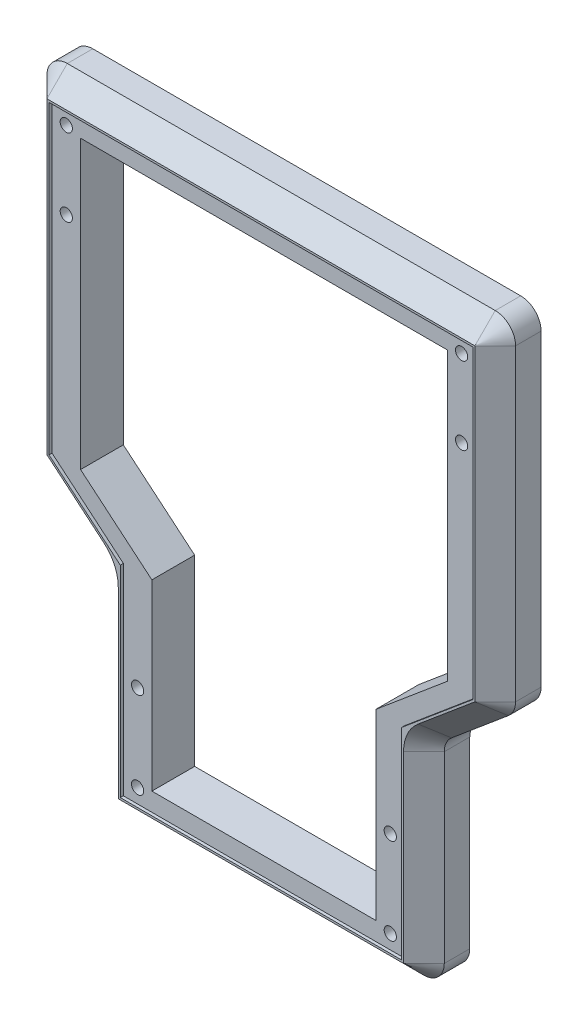
from build123d import *

# Parameters (mm, degrees)
RESSALTO_EXTRUS_O1_DEPTH = 22.5
CHANFRO1_SIZE            = 10
CORTE_EXTRUS_O1_REACH    = 324.073
ESBO_O3_W                = 1139.230904301
ESBO_O3_H                = 709.798033895
CORTE_EXTRUS_O5_DEPTH    = 1.5
ESBO_O5_R                = 3
CORTE_EXTRUS_O6_DEPTH    = 322.972048476
CORTE_EXTRUS_O8_DEPTH    = 10


with BuildPart() as part:
    # Esboço1 → Ressalto-extrusão1 (new, symmetric)
    with BuildSketch(Plane.XY):
        with BuildLine():
            Line((-70, 0), (70, 0))
            ThreePointArc((70, 0), (77.071067812, 2.928932188), (80, 10))
            Line((80, 10), (80, 100))
            ThreePointArc((80, 100), (80.93692213, 104.226182617), (83.572123903, 107.660444431))
            Line((83.572123903, 107.660444431), (111.427876097, 131.034195823))
            ThreePointArc((111.427876097, 131.034195823), (114.06307787, 134.468457637), (115, 138.694640254))
            Line((115, 138.694640254), (115, 290))
            ThreePointArc((115, 290), (112.071067812, 297.071067812), (105, 300))
            Line((105, 300), (-105, 300))
            ThreePointArc((-105, 300), (-112.071067812, 297.071067812), (-115, 290))
            Line((-115, 290), (-115, 138.694640254))
            ThreePointArc((-115, 138.694640254), (-114.06307787, 134.468457637), (-111.427876097, 131.034195823))
            Line((-111.427876097, 131.034195823), (-83.572123903, 107.660444431))
            ThreePointArc((-83.572123903, 107.660444431), (-80.93692213, 104.226182617), (-80, 100))
            Line((-80, 100), (-80, 10))
            ThreePointArc((-80, 10), (-77.071067812, 2.928932188), (-70, 0))
        make_face()
        Polygon((-55, 20), (55, 20), (55, 109.793731589), (90, 139.16221868), (90, 280), (-90, 280), (-90, 139.16221868), (-55, 109.793731589), align=None, mode=Mode.SUBTRACT)
    extrude(amount=RESSALTO_EXTRUS_O1_DEPTH, both=True)

    # Chanfro1
    chanfro1_edges = [part.edges().sort_by_distance(p)[0] for p in [
        (114.06307787, 134.468457637, 22.5),
        (115, 214.347320127, 22.5),
        (115, 214.347320127, -22.5),
        (114.06307787, 134.468457637, -22.5),
        (97.5, 119.347320127, -22.5),
        (80.93692213, 104.226182617, -22.5),
        (80, 55, -22.5),
        (77.071067812, 2.928932188, -22.5),
        (0, 0, -22.5),
        (-77.071067812, 2.928932188, -22.5),
        (-80, 55, -22.5),
        (-80.93692213, 104.226182617, -22.5),
        (-97.5, 119.347320127, -22.5),
        (-114.06307787, 134.468457637, -22.5),
        (-115, 214.347320127, -22.5),
        (-112.071067812, 297.071067812, -22.5),
        (0, 300, -22.5),
        (112.071067812, 297.071067812, -22.5),
        (112.071067812, 297.071067812, 22.5),
        (0, 300, 22.5),
        (-112.071067812, 297.071067812, 22.5),
        (-115, 214.347320127, 22.5),
        (-114.06307787, 134.468457637, 22.5),
        (-97.5, 119.347320127, 22.5),
        (-80.93692213, 104.226182617, 22.5),
        (-80, 55, 22.5),
        (-77.071067812, 2.928932188, 22.5),
        (0, 0, 22.5),
        (77.071067812, 2.928932188, 22.5),
        (80, 55, 22.5),
        (80.93692213, 104.226182617, 22.5),
        (97.5, 119.347320127, 22.5),
    ]]
    chamfer(chanfro1_edges, length=CHANFRO1_SIZE - 0.0001)  # a hair under: the kernel refuses the full size

    # Esboço3 → Corte-extrusão1 (cut, up to next)
    with BuildSketch(Plane.XY, mode=Mode.PRIVATE) as corte_extrus_o1_sk1:
        with Locations((-153.157436203, 152.53565808)):
            Rectangle(ESBO_O3_W, ESBO_O3_H)
    corte_extrus_o1_tool1 = extrude(corte_extrus_o1_sk1.sketch, amount=-CORTE_EXTRUS_O1_REACH, mode=Mode.PRIVATE) & part.part
    add(corte_extrus_o1_tool1.solids().sort_by_distance((-153.157436, 152.535658, 0))[0], mode=Mode.SUBTRACT)

    # Esboço4 → Corte-extrusão5 (cut)
    with BuildSketch(Plane.XY.offset(22.5)):
        Polygon((104, 289), (-104, 289), (-104, 139.160947912), (-69, 109.792460821), (-69, 11), (69, 11), (69, 109.792460821), (104, 139.160947912), align=None)
        Polygon((-90, 280), (-90, 139.16221868), (-55, 109.793731589), (-55, 20), (0, 20), (55, 20), (55, 109.793731589), (90, 139.16221868), (90, 280), align=None, mode=Mode.SUBTRACT)
    extrude(amount=-CORTE_EXTRUS_O5_DEPTH, mode=Mode.SUBTRACT)

    # Esboço5 → Corte-extrusão6 (cut, through all)
    with BuildSketch(Plane.XY.offset(21)):
        with Locations((-97, 244)):
            Circle(ESBO_O5_R)
        with Locations((-62, 60.396230411)):
            Circle(ESBO_O5_R)
        with Locations((-97, 282)):
            Circle(ESBO_O5_R)
        with Locations((-62, 18)):
            Circle(ESBO_O5_R)
        with Locations(Location((62, 18, 0), (0, 0, 180))):
            Circle(ESBO_O5_R)
        with Locations(Location((97, 282, 0), (0, 0, 180))):
            Circle(ESBO_O5_R)
        with Locations(Location((62, 60.396230411, 0), (0, 0, 180))):
            Circle(ESBO_O5_R)
        with Locations(Location((97, 244, 0), (0, 0, 180))):
            Circle(ESBO_O5_R)
    extrude(amount=-CORTE_EXTRUS_O6_DEPTH, mode=Mode.SUBTRACT)

    # Esboço7 → Corte-extrusão8 (cut)
    with BuildSketch(Plane(origin=(0, 0, 0), x_dir=(-1, 0, 0), z_dir=(0, 0, -1))):
        Polygon((-96.223646947, 288.060191195), (-101.860103, 285.702437064), (-102.636456053, 279.642245869), (-97.776353053, 275.939808805), (-92.139897, 278.297562936), (-91.363543947, 284.357754131), align=None)
        Polygon((-96.739022153, 247.917298035), (-100.261990689, 246.184662463), (-100.522968536, 242.267364427), (-97.260977847, 240.082701965), (-93.738009311, 241.815337537), (-93.477031464, 245.732635573), align=None)
        Polygon((-62, 64.322212241), (-65.4, 62.359221326), (-65.4, 58.433239495), (-62, 56.47024858), (-58.6, 58.433239495), (-58.6, 62.359221326), align=None)
        Polygon((-62, 19.92598183), (-63.667949192, 18.962990915), (-63.667949192, 17.037009085), (-62, 16.07401817), (-60.332050808, 17.037009085), (-60.332050808, 18.962990915), align=None)
        Polygon((62.727937948, 19.561318936), (61.011827112, 19.411072223), (60.283889164, 17.849753287), (61.272062052, 16.438681064), (62.988172888, 16.588927777), (63.716110836, 18.150246713), align=None)
        Polygon((62, 64.322212241), (58.6, 62.359221326), (58.6, 58.433239495), (62, 56.47024858), (65.4, 58.433239495), (65.4, 62.359221326), align=None)
        Polygon((97, 247.92598183), (93.6, 245.962990915), (93.6, 242.037009085), (97, 240.07401817), (100.4, 242.037009085), (100.4, 245.962990915), align=None)
        Polygon((97, 287.92598183), (91.867949192, 284.962990915), (91.867949192, 279.037009085), (97, 276.07401817), (102.132050808, 279.037009085), (102.132050808, 284.962990915), align=None)
    extrude(amount=-CORTE_EXTRUS_O8_DEPTH, mode=Mode.SUBTRACT)


solid = part.part
